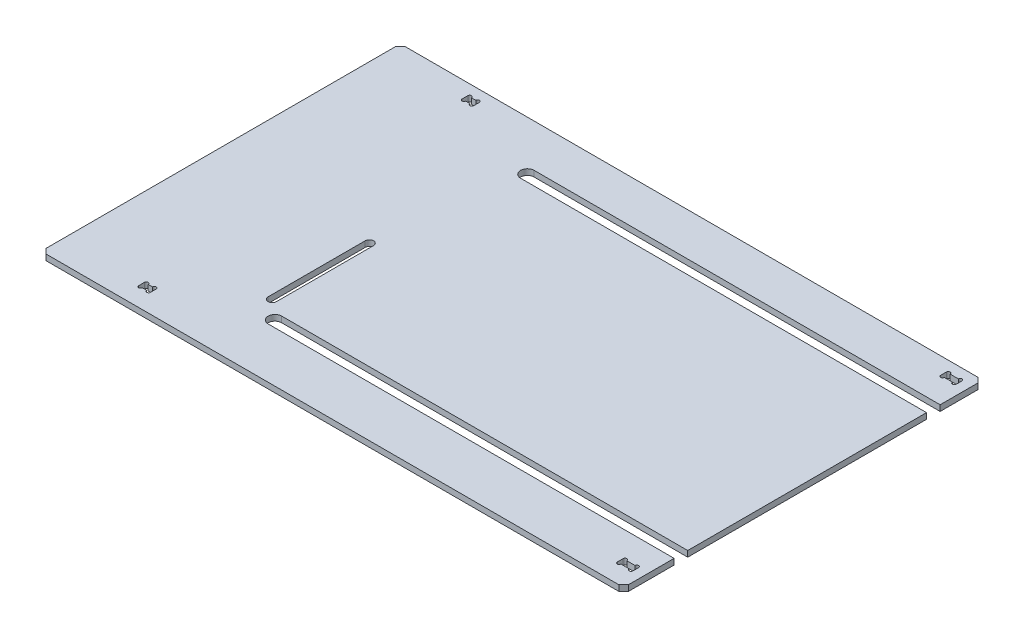
from build123d import *

# Parameters (mm, degrees)
SKETCH_1_W          = 300
SKETCH_1_H          = 185
EXTRUDE_1_DEPTH     = 3
CUT_EXTRUDE_1_DEPTH = 10
SKETCH_3_R          = 2.15
CUT_EXTRUDE_2_DEPTH = 10
SKETCH_4_W          = 209.1
SKETCH_4_H          = 7
CUT_EXTRUDE_3_DEPTH = 10
SKETCH_5_R          = 3.5
CUT_EXTRUDE_5_DEPTH = 10
CHAMFER_1_SIZE      = 2.5
SKETCH_6_W          = 6
SKETCH_6_H          = 3
SKETCH_6_W_2        = 8
CUT_EXTRUDE_6_DEPTH = 3
SKETCH_7_R          = 0.94219208
CUT_EXTRUDE_7_DEPTH = 10


with BuildPart() as part:
    # 스케치1 → 보스-돌출1 (new body)
    with BuildSketch(Plane(origin=(0, 0, 0), x_dir=(1, 0, 0), z_dir=(0, 1, 0))):
        with Locations((150, 92.5)):
            Rectangle(SKETCH_1_W, SKETCH_1_H)
    extrude(amount=EXTRUDE_1_DEPTH)

    # 스케치2 → 컷-돌출1 (cut)
    with BuildSketch(Plane(origin=(0, 3, 0), x_dir=(1, 0, 0), z_dir=(0, 1, 0))):
        Polygon((78.8, 63.106579113), (78.8, 88.106579113), (83.1, 88.106579113), (83.1, 38.106579113), (78.8, 38.106579113), align=None)
    extrude(amount=-CUT_EXTRUDE_1_DEPTH, mode=Mode.SUBTRACT)

    # 스케치3 → 컷-돌출2 (cut)
    with BuildSketch(Plane(origin=(0, 3, 0), x_dir=(1, 0, 0), z_dir=(0, 1, 0))):
        with Locations((80.95, 88.106579113)):
            Circle(SKETCH_3_R)
        with Locations((80.95, 38.106579113)):
            Circle(SKETCH_3_R)
    extrude(amount=-CUT_EXTRUDE_2_DEPTH, mode=Mode.SUBTRACT)

    # 스케치4 → 컷-돌출3 (cut)
    with BuildSketch(Plane(origin=(0, 3, 0), x_dir=(1, 0, 0), z_dir=(0, 1, 0))):
        with Locations((195.45, 159.5)):
            Rectangle(SKETCH_4_W, SKETCH_4_H)
        with Locations((195.45, 29.5)):
            Rectangle(SKETCH_4_W, SKETCH_4_H)
    extrude(amount=-CUT_EXTRUDE_3_DEPTH, mode=Mode.SUBTRACT)

    # 스케치5 → 컷-돌출5 (cut)
    with BuildSketch(Plane(origin=(0, 3, 0), x_dir=(1, 0, 0), z_dir=(0, 1, 0))):
        with Locations((90.9, 159.5)):
            Circle(SKETCH_5_R)
        with Locations((90.9, 29.5)):
            Circle(SKETCH_5_R)
    extrude(amount=-CUT_EXTRUDE_5_DEPTH, mode=Mode.SUBTRACT)

    # 모따기1
    chamfer_1_edges = [part.edges().sort_by_distance(p)[0] for p in [
        (0, 1.5, 0),
        (0, 1.5, -185),
        (300, 1.5, 0),
        (300, 1.5, -185),
    ]]
    chamfer(chamfer_1_edges, length=CHAMFER_1_SIZE)

    # 스케치6 → 컷-돌출6 (cut)
    with BuildSketch(Plane.XZ):
        with Locations((43.5, -177.75)):
            Rectangle(SKETCH_6_W, SKETCH_6_H)
        with Locations((291, -177.75)):
            Rectangle(SKETCH_6_W_2, SKETCH_6_H)
        with Locations((291, -11.25)):
            Rectangle(SKETCH_6_W_2, SKETCH_6_H)
        with Locations((43.5, -11.25)):
            Rectangle(SKETCH_6_W, SKETCH_6_H)
    extrude(amount=-CUT_EXTRUDE_6_DEPTH, mode=Mode.SUBTRACT)

    # 스케치7 → 컷-돌출7 (cut)
    with BuildSketch(Plane(origin=(0, 3, 0), x_dir=(1, 0, 0), z_dir=(0, 1, 0))):
        with Locations((41.44219208, 12.75)):
            Circle(SKETCH_7_R)
        with Locations((45.55780792, 12.75)):
            Circle(SKETCH_7_R)
        with Locations((45.55780792, 9.75)):
            Circle(SKETCH_7_R)
        with Locations((41.44219208, 9.75)):
            Circle(SKETCH_7_R)
        with Locations((294.05780792, 9.75)):
            Circle(SKETCH_7_R)
        with Locations((294.05780792, 12.75)):
            Circle(SKETCH_7_R)
        with Locations((287.94219208, 12.75)):
            Circle(SKETCH_7_R)
        with Locations((287.94219208, 9.75)):
            Circle(SKETCH_7_R)
        with Locations((287.94219208, 179.25)):
            Circle(SKETCH_7_R)
        with Locations((287.94219208, 176.25)):
            Circle(SKETCH_7_R)
        with Locations((294.05780792, 176.25)):
            Circle(SKETCH_7_R)
        with Locations((294.05780792, 179.25)):
            Circle(SKETCH_7_R)
        with Locations((41.44219208, 179.25)):
            Circle(SKETCH_7_R)
        with Locations((45.55780792, 179.25)):
            Circle(SKETCH_7_R)
        with Locations((45.55780792, 176.25)):
            Circle(SKETCH_7_R)
        with Locations((41.44219208, 176.25)):
            Circle(SKETCH_7_R)
    extrude(amount=-CUT_EXTRUDE_7_DEPTH, mode=Mode.SUBTRACT)


solid = part.part
